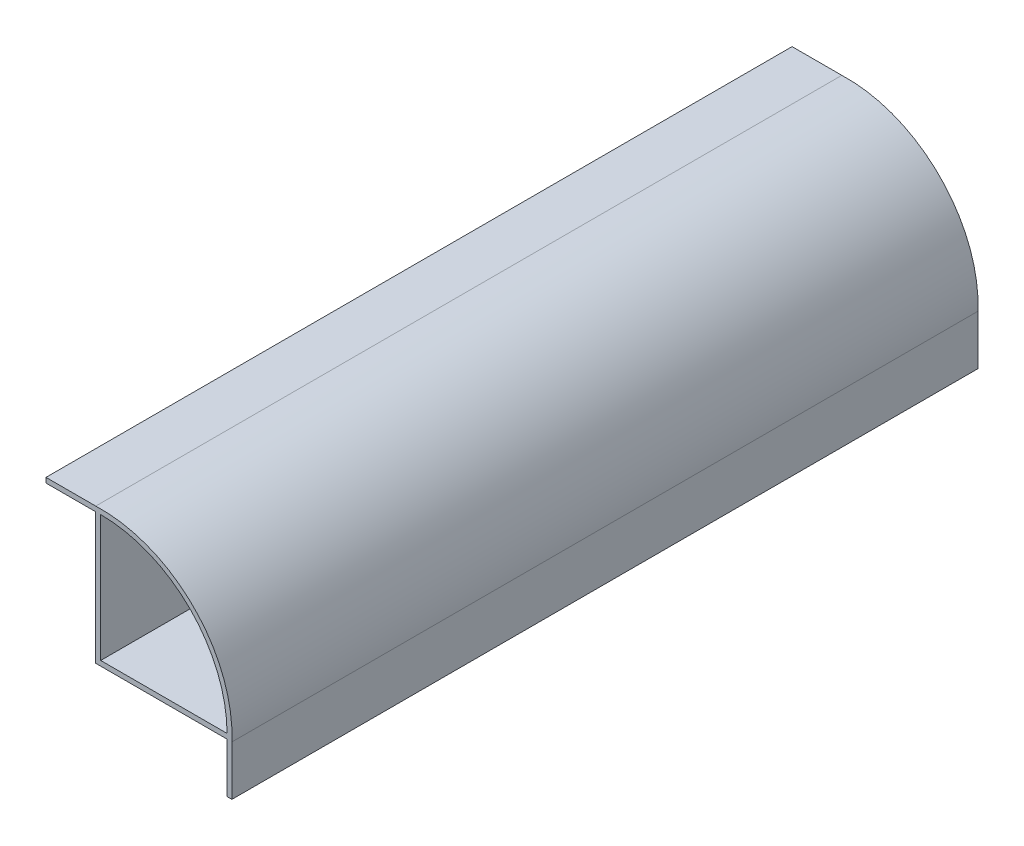
from build123d import *

# Parameters (mm, degrees)
SALIENTE_EXTRUIR1_DEPTH = 75


with BuildPart() as part:
    # Croquis1 → Saliente-Extruir1 (new, symmetric)
    with BuildSketch(Plane.XY):
        with BuildLine():
            Line((-13.7, 12.681053808), (-13.7, -13.7))
            Line((-13.7, -13.7), (12.681053808, -13.7))
            Line((12.681053808, -13.7), (12.681053808, -23.7))
            Line((12.681053808, -23.7), (13.681053808, -23.7))
            Line((13.681053808, -23.7), (13.681053808, -13.7))
            ThreePointArc((13.681053808, -13.7), (5.967619023, 5.967619023), (-13.7, 13.681053808))
            Line((-13.7, 13.681053808), (-23.7, 13.681053808))
            Line((-23.7, 13.681053808), (-23.7, 12.681053808))
            Line((-23.7, 12.681053808), (-13.7, 12.681053808))
        make_face()
        with BuildLine():
            Line((12.7, -12.7), (-12.7, -12.7))
            Line((-12.7, -12.7), (-12.7, 12.7))
            ThreePointArc((-12.7, 12.7), (5.260512242, 5.260512242), (12.7, -12.7))
        make_face(mode=Mode.SUBTRACT)
    extrude(amount=SALIENTE_EXTRUIR1_DEPTH, both=True)


solid = part.part
